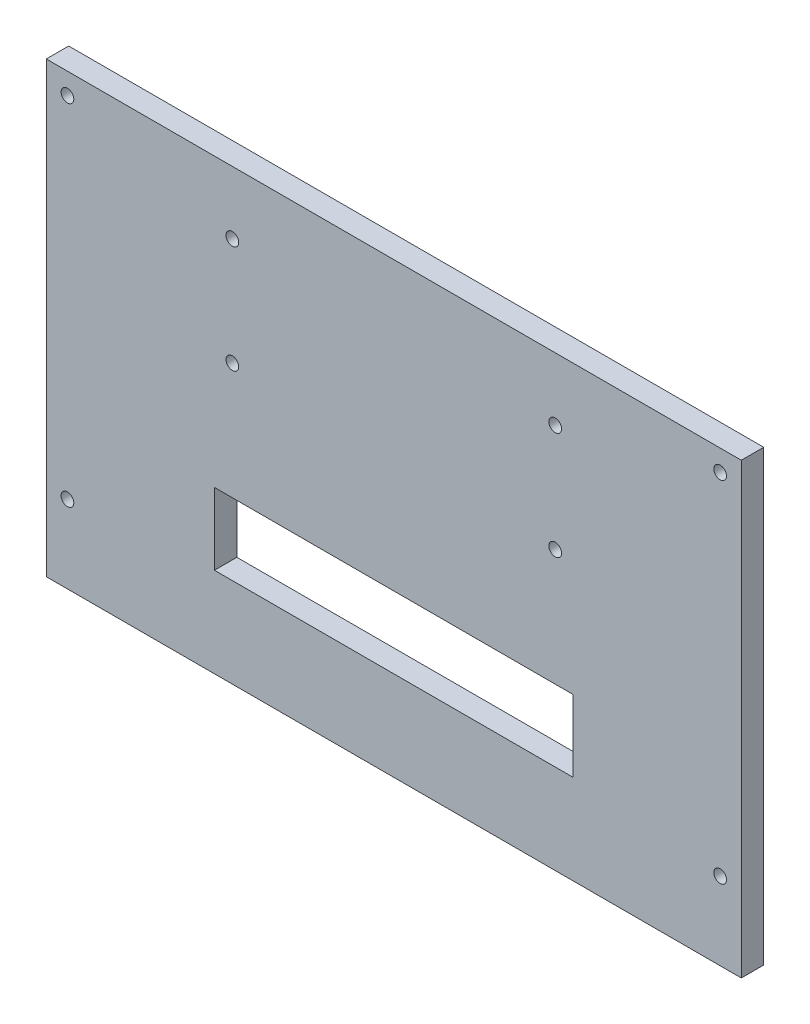
from build123d import *

# Parameters (mm, degrees)
SKETCH1_W            = 196.85
SKETCH1_H            = 127
BOSS_EXTRUDE1_DEPTH  = 6.35
M3_CLEARANCE_HOLE1_D = 3.6
SKETCH7_W            = 101.6
SKETCH7_H            = 20.32
TUBINGSLOT_DEPTH     = 235.348554508
M3_CLEARANCE_HOLE2_D = 3.6


with BuildPart() as part:
    # Sketch1 → Boss-Extrude1 (new body)
    with BuildSketch(Plane.XY):
        with Locations((98.425, 63.5)):
            Rectangle(SKETCH1_W, SKETCH1_H)
    extrude(amount=BOSS_EXTRUDE1_DEPTH)

    # M3 Clearance Hole1 (through all)
    with Locations(Plane.XY.offset(6.35)):
        with Locations((5.9944, 121.0056), (5.9944, 21.9964), (190.8556, 21.9964), (190.8556, 121.0056)):
            Hole(M3_CLEARANCE_HOLE1_D / 2)

    # Sketch7 → tubingslot (cut, through all)
    with BuildSketch(Plane.XY.offset(6.35)):
        with Locations((98.425, 35.56)):
            Rectangle(SKETCH7_W, SKETCH7_H)
    extrude(amount=-TUBINGSLOT_DEPTH, mode=Mode.SUBTRACT)

    # M3 Clearance Hole2 (through all)
    with Locations(Plane.XY.offset(6.35)):
        with Locations((52.705, 109.22), (144.145, 109.22), (52.705, 78.74), (144.145, 78.74)):
            Hole(M3_CLEARANCE_HOLE2_D / 2)


solid = part.part
